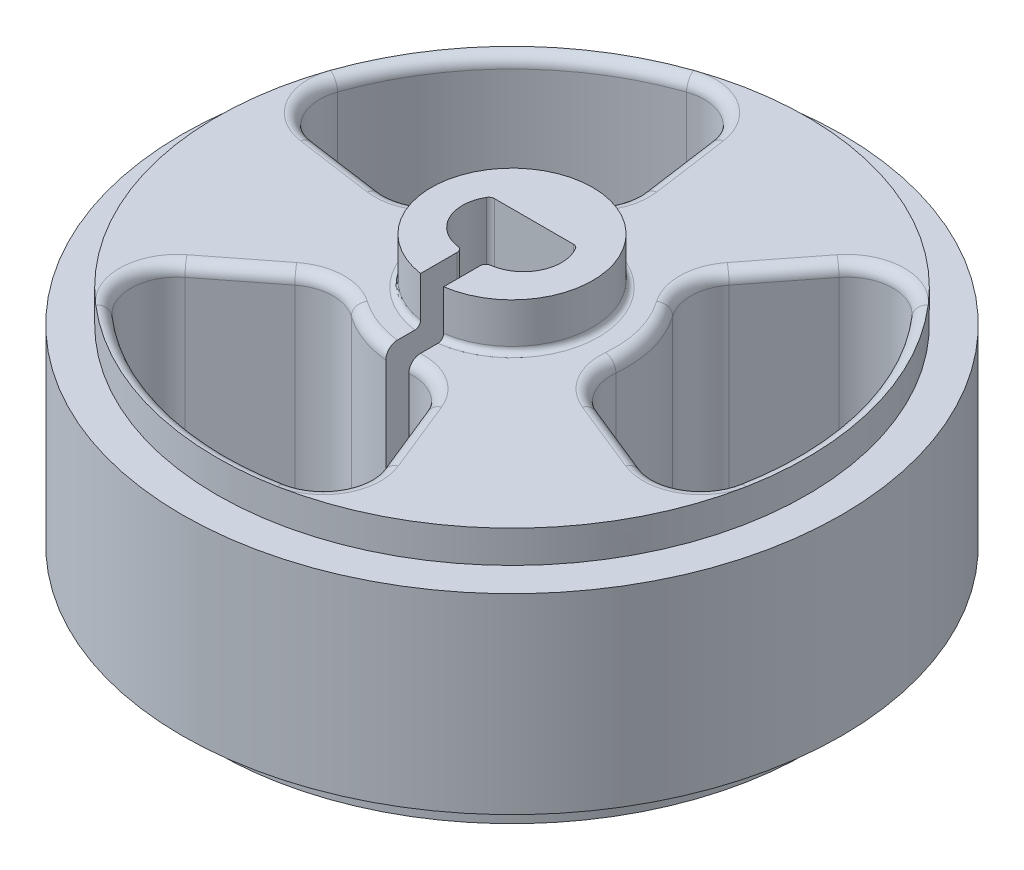
from build123d import *

# Parameters (mm, degrees)
CUT_EXTRUDE1_DEPTH       = 24.069243594
FILLET1_R                = 2
FILLET2_R                = 0.5
CIRPATTERN1_COUNT        = 3
FILLET1_OF_CIRPATTERN1_R = 2
FILLET2_OF_CIRPATTERN1_R = 0.5
CUT_EXTRUDE3_DEPTH       = 25.095435307
FILLET3_R                = 0.25
FILLET4_R                = 0.25


with BuildPart() as part:
    # Sketch1 → Revolve1 (revolve)
    with BuildSketch(Plane(origin=(0, 0, 0), x_dir=(0, 0, -1), z_dir=(1, 0, 0)), mode=Mode.PRIVATE) as revolve1_sk:
        Polygon((0, -6.55), (12.8, -6.55), (12.8, -5.15), (14.3, -5.15), (14.3, 3.15), (12.8, 3.15), (12.8, 4.55), (3.5, 4.55), (3.5, 6.55), (0, 6.55), align=None)
    revolve(revolve1_sk.sketch.rotate(Axis((0, 7.622905435, 0), (0, -1, 0)), 180), axis=Axis((0, 7.622905435, 0), (0, -1, 0)))

    # Sketch2 → Cut-Extrude1 (cut, through all)
    with BuildSketch(Plane(origin=(0, 4.55, 0), x_dir=(1, 0, 0), z_dir=(0, 1, 0))):
        with BuildLine():
            Line((-1.711829142, 12.180297246), (-0.695865505, 4.951340344))
            ThreePointArc((-0.695865505, 4.951340344), (-3.535533906, 3.535533906), (-4.951340344, 0.695865505))
            Line((-4.951340344, 0.695865505), (-12.180297246, 1.711829142))
            ThreePointArc((-12.180297246, 1.711829142), (-8.697413409, 8.697413409), (-1.711829142, 12.180297246))
        make_face()
    cut_extrude1 = extrude(amount=-CUT_EXTRUDE1_DEPTH, mode=Mode.SUBTRACT)

    # Fillet1
    fillet1_edges = [part.edges().sort_by_distance(p)[0] for p in [
        (-12.180297246, -1, -1.711829142),
        (-1.711829142, -1, -12.180297246),
        (-0.695865505, -1, -4.951340344),
        (-4.951340344, -1, -0.695865505),
    ]]
    fillet(fillet1_edges, radius=FILLET1_R)

    # Fillet2
    fillet2_edges = [part.edges().sort_by_distance(p)[0] for p in [
        (-3.535533906, 4.55, -3.535533906),
        (-3.535533906, -6.55, -3.535533906),
        (-8.324274366, 4.55, -1.169900468),
        (-8.324274366, -6.55, -1.169900468),
        (-1.169900468, 4.55, -8.324274366),
        (-1.169900468, -6.55, -8.324274366),
        (-8.697413409, 4.55, -8.697413409),
        (-8.697413409, -6.55, -8.697413409),
        (-5.404150679, 4.55, -1.159832365),
        (-5.404150679, -6.55, -1.159832365),
        (-1.159832365, 4.55, -5.404150679),
        (-1.159832365, -6.55, -5.404150679),
        (-11.43435232, 4.55, -2.344664413),
        (-11.43435232, -6.55, -2.344664413),
        (-2.344664413, 4.55, -11.43435232),
        (-2.344664413, -6.55, -11.43435232),
    ]]
    fillet(fillet2_edges, radius=FILLET2_R - 0.0001)  # a hair under: the kernel refuses the full size

    # CirPattern1: Cut-Extrude1 ×3 about axis
    cirpattern1_axis = Axis((0, 0, 0), (0, 1, 0))
    for i in range(1, CIRPATTERN1_COUNT):
        add(cut_extrude1.rotate(cirpattern1_axis, i * 360 / CIRPATTERN1_COUNT), mode=Mode.SUBTRACT)

    # Fillet1 of CirPattern1
    fillet1_of_cirpattern1_edges = [part.edges().sort_by_distance(p)[0] for p in [
        (4.607661099, -1, 11.404361411),
        (-9.692532269, -1, 7.572636147),
        (-3.940053768, -1, 3.078307377),
        (1.873032967, -1, 4.635919273),
        (7.572636147, -1, -9.692532269),
        (11.404361411, -1, 4.607661099),
        (4.635919273, -1, 1.873032967),
        (3.078307377, -1, -3.940053768),
    ]]
    fillet(fillet1_of_cirpattern1_edges, radius=FILLET1_OF_CIRPATTERN1_R)

    # Fillet2 of CirPattern1
    fillet2_of_cirpattern1_edges = [part.edges().sort_by_distance(p)[0] for p in [
        (-1.294095226, 4.55, 4.829629131),
        (-1.294095226, -6.55, 4.829629131),
        (3.148973658, 4.55, 7.793983303),
        (3.148973658, -6.55, 7.793983303),
        (-6.624082835, 4.55, 5.175300708),
        (-6.624082835, -6.55, 5.175300708),
        (-3.183474255, 4.55, 11.880887663),
        (-3.183474255, -6.55, 11.880887663),
        (1.697631047, 4.55, 5.260047957),
        (1.697631047, -6.55, 5.260047957),
        (-4.100215591, 4.55, 3.706519632),
        (-4.100215591, -6.55, 3.706519632),
        (3.686637215, 4.55, 11.074771791),
        (3.686637215, -6.55, 11.074771791),
        (-8.730107378, 4.55, 7.747715105),
        (-8.730107378, -6.55, 7.747715105),
        (4.829629131, 4.55, -1.294095226),
        (4.829629131, -6.55, -1.294095226),
        (5.175300708, 4.55, -6.624082835),
        (5.175300708, -6.55, -6.624082835),
        (7.793983303, 4.55, 3.148973658),
        (7.793983303, -6.55, 3.148973658),
        (11.880887663, 4.55, -3.183474255),
        (11.880887663, -6.55, -3.183474255),
        (3.706519632, 4.55, -4.100215591),
        (3.706519632, -6.55, -4.100215591),
        (5.260047957, 4.55, 1.697631047),
        (5.260047957, -6.55, 1.697631047),
        (7.747715105, 4.55, -8.730107378),
        (7.747715105, -6.55, -8.730107378),
        (11.074771791, 4.55, 3.686637215),
        (11.074771791, -6.55, 3.686637215),
    ]]
    fillet(fillet2_of_cirpattern1_edges, radius=FILLET2_OF_CIRPATTERN1_R - 0.0001)  # a hair under: the kernel refuses the full size

    # Sketch3 → Cut-Extrude3 (cut, through all)
    with BuildSketch(Plane(origin=(0, 6.55, 0), x_dir=(1, 0, 0), z_dir=(0, 1, 0))):
        with BuildLine():
            Line((-0.5, -5.65), (-0.5, -1.65))
            ThreePointArc((-0.5, -1.65), (-1.964581852, -0.759934208), (-1.849073756, 0.95))
            Line((-1.849073756, 0.95), (1.849073756, 0.95))
            ThreePointArc((1.849073756, 0.95), (1.964581852, -0.759934208), (0.5, -1.65))
            Line((0.5, -1.65), (0.5, -5.65))
            Line((0.5, -5.65), (-0.5, -5.65))
        make_face()
    extrude(amount=-CUT_EXTRUDE3_DEPTH, mode=Mode.SUBTRACT)

    # Fillet3
    fillet3_edges = [part.edges().sort_by_distance(p)[0] for p in [
        (0.5, 0, 1.65),
        (-0.5, 0, 1.65),
        (-1.849073756, 0, -0.95),
        (1.849073756, 0, -0.95),
    ]]
    fillet(fillet3_edges, radius=FILLET3_R)

    # Fillet4
    fillet4_edges = [part.edges().sort_by_distance(p)[0] for p in [
        (0, 4.55, -3.5),
    ]]
    fillet(fillet4_edges, radius=FILLET4_R)


solid = part.part
